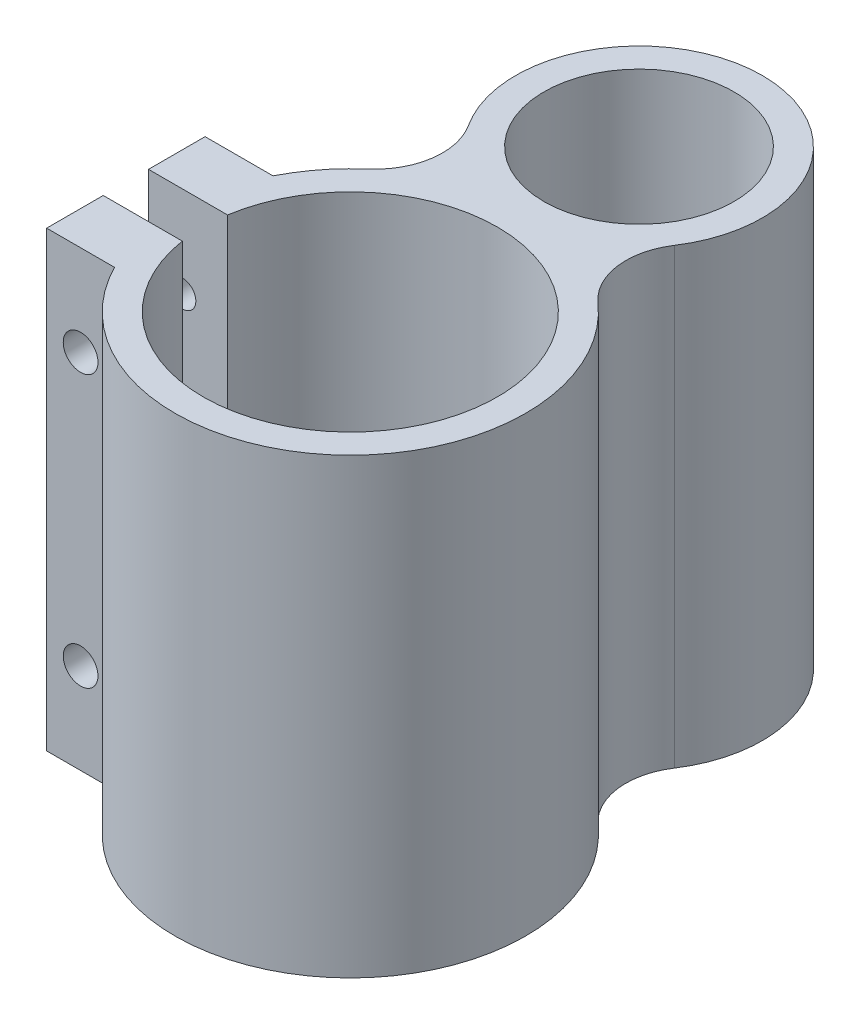
from build123d import *

# Parameters (mm, degrees)
SKETCH1_R           = 10.668
BOSS_EXTRUDE1_DEPTH = 50.8
FILLET1_R           = 7.62
SKETCH2_R           = 1.95
CUT_EXTRUDE1_DEPTH  = 75.627023796
CUT_EXTRUDE3_REACH  = 69.734
SKETCH3_R           = 1.5


with BuildPart() as part:
    # Sketch1 → Boss-Extrude1 (new body)
    with BuildSketch(Plane(origin=(0, 0, 0), x_dir=(1, 0, 0), z_dir=(0, 1, 0))):
        with BuildLine():
            Line((-24.955550392, -20.838342509), (-24.955550392, -27.188342509))
            Line((-24.955550392, -27.188342509), (-17.335550392, -27.188342509))
            ThreePointArc((-17.335550392, -27.188342509), (15.676160035, -30.498495999), (4.804929448, 0.84710157))
            ThreePointArc((4.804929448, 0.84710157), (0.420168631, 27.800751043), (-4.189525374, 0.884657929))
            ThreePointArc((-4.189525374, 0.884657929), (-11.907860758, -2.799057627), (-17.335550392, -9.408342509))
            Line((-17.335550392, -9.408342509), (-24.955550392, -9.408342509))
            Line((-24.955550392, -9.408342509), (-24.955550392, -15.758342509))
            Line((-24.955550392, -15.758342509), (-16.085763576, -15.758342509))
            ThreePointArc((-16.085763576, -15.758342509), (16.737681799, -18.298342509), (-16.085763576, -20.838342509))
            Line((-16.085763576, -20.838342509), (-24.955550392, -20.838342509))
        make_face()
        with Locations((0.362367668, 13.957871716)):
            Circle(SKETCH1_R, mode=Mode.SUBTRACT)
    extrude(amount=BOSS_EXTRUDE1_DEPTH)

    # Fillet1
    fillet1_edges = [part.edges().sort_by_distance(p)[0] for p in [
        (-4.189525374, 25.4, -0.884657929),
        (4.804929448, 25.4, -0.84710157),
    ]]
    fillet(fillet1_edges, radius=FILLET1_R)

    # Sketch2 → Cut-Extrude1 (cut, through all)
    with BuildSketch(Plane(origin=(0, 0, 20.838342509), x_dir=(-1, 0, 0), z_dir=(0, 0, -1))):
        with Locations((21.145550392, 40.64)):
            Circle(SKETCH2_R)
        with Locations((21.145550392, 10.16)):
            Circle(SKETCH2_R)
    extrude(amount=-CUT_EXTRUDE1_DEPTH, mode=Mode.SUBTRACT)

    # Sketch3 → Cut-Extrude3 (cut, up to next)
    with BuildSketch(Plane(origin=(0, 0, 9.408342509), x_dir=(-1, 0, 0), z_dir=(0, 0, -1)), mode=Mode.PRIVATE) as cut_extrude3_sk1:
        with Locations((21.145550392, 40.64)):
            Circle(SKETCH3_R)
    cut_extrude3_tool1 = extrude(cut_extrude3_sk1.sketch, amount=-CUT_EXTRUDE3_REACH, mode=Mode.PRIVATE) & part.part
    # Sketch3 → Cut-Extrude3 (cut, up to next)
    with BuildSketch(Plane(origin=(0, 0, 9.408342509), x_dir=(-1, 0, 0), z_dir=(0, 0, -1)), mode=Mode.PRIVATE) as cut_extrude3_sk2:
        with Locations((21.145550392, 10.16)):
            Circle(SKETCH3_R)
    cut_extrude3_tool2 = extrude(cut_extrude3_sk2.sketch, amount=-CUT_EXTRUDE3_REACH, mode=Mode.PRIVATE) & part.part
    add(cut_extrude3_tool1.solids().sort_by_distance((-21.14555, 40.64, 9.408343))[0], mode=Mode.SUBTRACT)
    add(cut_extrude3_tool2.solids().sort_by_distance((-21.14555, 10.16, 9.408343))[0], mode=Mode.SUBTRACT)


solid = part.part
